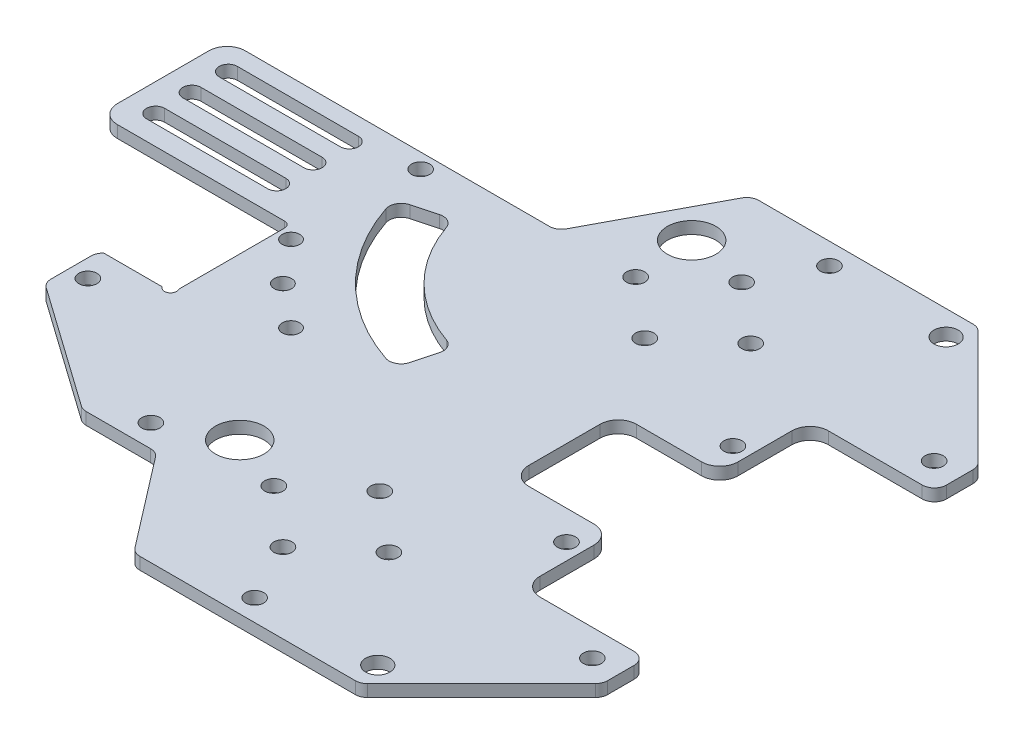
from build123d import *

# Parameters (mm, degrees)
SKETCH1_R           = 1.5
SKETCH1_R_2         = 2
SKETCH1_R_3         = 1.45
BOSS_EXTRUDE1_DEPTH = 2
CUT_EXTRUDE1_DEPTH  = 2
FILLET1_R           = 3
SKETCH3_R           = 1.5
CUT_EXTRUDE2_DEPTH  = 10
SKETCH_1_W          = 11.141106223
SKETCH_1_H          = 2.064068387
CUT_EXTRUDE_1_DEPTH = 10
SKETCH_2_R          = 4
CUT_EXTRUDE_2_DEPTH = 96.448488805
FILLET2_R           = 2
SKETCH4_R           = 1
CUT_EXTRUDE3_DEPTH  = 10
SKETCH5_W           = 11.82747082
SKETCH5_H           = 19.50302412
CUT_EXTRUDE4_DEPTH  = 10
FILLET3_R           = 1


with BuildPart() as part:
    # Sketch1 → Boss-Extrude1 (new body)
    with BuildSketch(Plane(origin=(0, 0, 0), x_dir=(1, 0, 0), z_dir=(0, 1, 0))):
        with BuildLine():
            Line((54.869224403, -12.305407816), (44.089868135, -12.305407816))
            ThreePointArc((44.089868135, -12.305407816), (41.968547791, -11.42672816), (41.089868135, -9.305407816))
            Line((41.089868135, -9.305407816), (41.089868135, 2.471948803))
            ThreePointArc((41.089868135, 2.471948803), (41.968547791, 4.593269147), (44.089868135, 5.471948803))
            Line((44.089868135, 5.471948803), (54.869224403, 5.471948803))
            ThreePointArc((54.869224403, 5.471948803), (56.990544747, 6.35062846), (57.869224403, 8.471948803))
            Line((57.869224403, 8.471948803), (57.869224403, 17.375765412))
            ThreePointArc((57.869224403, 17.375765412), (58.74790406, 19.497085755), (60.869224403, 20.375765412))
            Line((60.869224403, 20.375765412), (78.389804663, 20.375765412))
            Line((78.389804663, 20.375765412), (78.389804663, 27.585770494))
            Line((78.389804663, 27.585770494), (58.389804663, 47.585770494))
            Line((58.389804663, 47.585770494), (20.979804663, 47.585770494))
            Line((20.979804663, 47.585770494), (9.812981375, 26.583270494))
            Line((9.812981375, 26.583270494), (-13.868656246, 26.583270494))
            Line((-13.868656246, 26.583270494), (-44.620364758, 26.583270494))
            Line((-44.620364758, 26.583270494), (-44.620364758, 5.471948803))
            Line((-44.620364758, 5.471948803), (-13.868656246, 5.471948803))
            Line((-13.868656246, 5.471948803), (-13.868656246, -11.444658054))
            Line((-13.868656246, -11.444658054), (-25.009762469, -11.444658054))
            Line((-25.009762469, -11.444658054), (-25.009762469, -23.143538054))
            Line((-25.009762469, -23.143538054), (-3.796559034, -38.143538054))
            Line((-3.796559034, -38.143538054), (8.464513563, -38.143538054))
            Line((8.464513563, -38.143538054), (20.979804663, -54.419229506))
            Line((20.979804663, -54.419229506), (58.389804663, -54.419229506))
            Line((58.389804663, -54.419229506), (78.389804663, -34.419229506))
            Line((78.389804663, -34.419229506), (78.389804663, -27.209224425))
            Line((78.389804663, -27.209224425), (60.869224403, -27.209224425))
            ThreePointArc((60.869224403, -27.209224425), (58.74790406, -26.330544768), (57.869224403, -24.209224425))
            Line((57.869224403, -24.209224425), (57.869224403, -15.305407816))
            ThreePointArc((57.869224403, -15.305407816), (56.990544747, -13.184087473), (54.869224403, -12.305407816))
        make_face()
        with Locations((32.479804663, -41.294229506)):
            Circle(SKETCH1_R, mode=Mode.SUBTRACT)
        with Locations((41.979804663, -33.294229506)):
            Circle(SKETCH1_R, mode=Mode.SUBTRACT)
        with Locations((32.479804663, -25.294229506)):
            Circle(SKETCH1_R, mode=Mode.SUBTRACT)
        with Locations((22.979804663, -33.294229506)):
            Circle(SKETCH1_R, mode=Mode.SUBTRACT)
        with Locations((-10.194098263, 24.120202053)):
            Circle(SKETCH1_R, mode=Mode.SUBTRACT)
        with Locations((-22.049699545, -18.984613762)):
            Circle(SKETCH1_R, mode=Mode.SUBTRACT)
        with Locations((3.798471154, -34.419229506)):
            Circle(SKETCH1_R, mode=Mode.SUBTRACT)
        with Locations((57.193929966, -50.345885936)):
            Circle(SKETCH1_R_2, mode=Mode.SUBTRACT)
        with Locations((55.174344354, -17.159547773)):
            Circle(SKETCH1_R, mode=Mode.SUBTRACT)
        with Locations((55.174344354, 10.32608876)):
            Circle(SKETCH1_R, mode=Mode.SUBTRACT)
        with Locations((-10.866471131, 3.389008325)):
            Circle(SKETCH1_R_3, mode=Mode.SUBTRACT)
        with Locations((-5.208623843, -3.610189063)):
            Circle(SKETCH1_R_3, mode=Mode.SUBTRACT)
        with Locations((1.790573544, -9.268036351)):
            Circle(SKETCH1_R_3, mode=Mode.SUBTRACT)
        with Locations((57.193929966, 43.512426923)):
            Circle(SKETCH1_R_2, mode=Mode.SUBTRACT)
        with Locations((22.979804663, 26.460770494)):
            Circle(SKETCH1_R, mode=Mode.SUBTRACT)
        with Locations((32.479804663, 18.460770494)):
            Circle(SKETCH1_R, mode=Mode.SUBTRACT)
        with Locations((41.979804663, 26.460770494)):
            Circle(SKETCH1_R, mode=Mode.SUBTRACT)
        with Locations((32.479804663, 34.460770494)):
            Circle(SKETCH1_R, mode=Mode.SUBTRACT)
        with BuildLine():
            Line((16.558909908, -4.425834893), (17.596504785, -0.553478093))
            ThreePointArc((17.596504785, -0.553478093), (17.431334664, 0.901622726), (16.318958433, 1.854103006))
            ThreePointArc((16.318958433, 1.854103006), (6.440151022, 8.038585802), (0.255668225, 17.917393213))
            ThreePointArc((0.255668225, 17.917393213), (-0.696812054, 19.029769444), (-2.151912873, 19.194939566))
            Line((-2.151912873, 19.194939566), (-6.024269674, 18.157344688))
            ThreePointArc((-6.024269674, 18.157344688), (-7.269100914, 17.170851095), (-7.402354016, 15.588126218))
            ThreePointArc((-7.402354016, 15.588126218), (0.783296772, 2.381731553), (13.989691438, -5.803919235))
            ThreePointArc((13.989691438, -5.803919235), (15.572416314, -5.670666133), (16.558909908, -4.425834893))
        make_face(mode=Mode.SUBTRACT)
    extrude(amount=BOSS_EXTRUDE1_DEPTH)

    # Sketch2 → Cut-Extrude1 (cut)
    with BuildSketch(Plane.XZ):
        with BuildLine():
            Line((-40.041862968, -8.700189144), (-20.041862968, -8.700189144))
            ThreePointArc((-20.041862968, -8.700189144), (-18.541862968, -10.200189144), (-20.041862968, -11.700189144))
            Line((-20.041862968, -11.700189144), (-40.041862968, -11.700189144))
            ThreePointArc((-40.041862968, -11.700189144), (-41.541862968, -10.200189144), (-40.041862968, -8.700189144))
        make_face()
        with BuildLine():
            Line((-40.041862968, -17.700189144), (-20.041862968, -17.700189144))
            ThreePointArc((-20.041862968, -17.700189144), (-18.541862968, -16.200189144), (-20.041862968, -14.700189144))
            Line((-20.041862968, -14.700189144), (-40.041862968, -14.700189144))
            ThreePointArc((-40.041862968, -14.700189144), (-41.541862968, -16.200189144), (-40.041862968, -17.700189144))
        make_face()
        with BuildLine():
            Line((-40.041862968, -23.700189144), (-20.041862968, -23.700189144))
            ThreePointArc((-20.041862968, -23.700189144), (-18.541862968, -22.200189144), (-20.041862968, -20.700189144))
            Line((-20.041862968, -20.700189144), (-40.041862968, -20.700189144))
            ThreePointArc((-40.041862968, -20.700189144), (-41.541862968, -22.200189144), (-40.041862968, -23.700189144))
        make_face()
    extrude(amount=-CUT_EXTRUDE1_DEPTH, mode=Mode.SUBTRACT)

    # Fillet1
    fillet1_edges = [part.edges().sort_by_distance(p)[0] for p in [
        (-44.620364758, 1, -5.471948803),
        (-44.620364758, 1, -26.583270494),
    ]]
    fillet(fillet1_edges, radius=FILLET1_R)

    # Sketch3 → Cut-Extrude2 (cut)
    with BuildSketch(Plane.XZ):
        with Locations((37.394868442, -44.049147495)):
            Circle(SKETCH3_R)
        with Locations((37.394868442, 50.882606508)):
            Circle(SKETCH3_R)
        with Locations((73.927423247, 31.637693078)):
            Circle(SKETCH3_R)
        with Locations((73.927423247, -24.804234066)):
            Circle(SKETCH3_R)
    extrude(amount=-CUT_EXTRUDE2_DEPTH, mode=Mode.SUBTRACT)

    # 草图1 → 切除-拉伸1 (cut)
    with BuildSketch(Plane.XZ):
        with Locations((-19.439209358, 12.476692248)):
            Rectangle(SKETCH_1_W, SKETCH_1_H)
    extrude(amount=-CUT_EXTRUDE_1_DEPTH, mode=Mode.SUBTRACT)

    # 草图2 → 切除-拉伸2 (cut, through all)
    with BuildSketch(Plane.XZ):
        with Locations((13.601488823, 29.543202895)):
            Circle(SKETCH_2_R)
        with Locations((22.351612258, -36.336152346)):
            Circle(SKETCH_2_R)
    extrude(amount=-CUT_EXTRUDE_2_DEPTH, mode=Mode.SUBTRACT)

    # Fillet2
    fillet2_edges = [part.edges().sort_by_distance(p)[0] for p in [
        (78.389804663, 1, -20.375765412),
        (78.389804663, 1, -27.585770494),
        (58.389804663, 1, -47.585770494),
        (20.979804663, 1, -47.585770494),
        (9.812981375, 1, -26.583270494),
        (78.389804663, 1, 34.419229506),
        (78.389804663, 1, 27.209224425),
        (58.389804663, 1, 54.419229506),
        (20.979804663, 1, 54.419229506),
        (8.464513563, 1, 38.143538054),
        (-3.796559034, 1, 38.143538054),
        (-25.009762469, 1, 23.143538054),
        (-25.009762469, 1, 13.508726441),
        (-13.868656246, 1, -5.471948803),
    ]]
    fillet(fillet2_edges, radius=FILLET2_R)

    # Sketch4 → Cut-Extrude3 (cut)
    with BuildSketch(Plane(origin=(0, 2, 0), x_dir=(1, 0, 0), z_dir=(0, 1, 0))):
        with Locations((-13.868656246, -13.508726441)):
            Circle(SKETCH4_R)
    extrude(amount=-CUT_EXTRUDE3_DEPTH, mode=Mode.SUBTRACT)

    # Sketch5 → Cut-Extrude4 (cut)
    with BuildSketch(Plane(origin=(0, 2, 0), x_dir=(1, 0, 0), z_dir=(0, 1, 0))):
        with Locations((-18.928899697, -4.279563257)):
            Rectangle(SKETCH5_W, SKETCH5_H)
    extrude(amount=-CUT_EXTRUDE4_DEPTH, mode=Mode.SUBTRACT)

    # Fillet3
    fillet3_edges = [part.edges().sort_by_distance(p)[0] for p in [
        (-13.015164287, 1, -5.471948803),
    ]]
    fillet(fillet3_edges, radius=FILLET3_R)


solid = part.part
